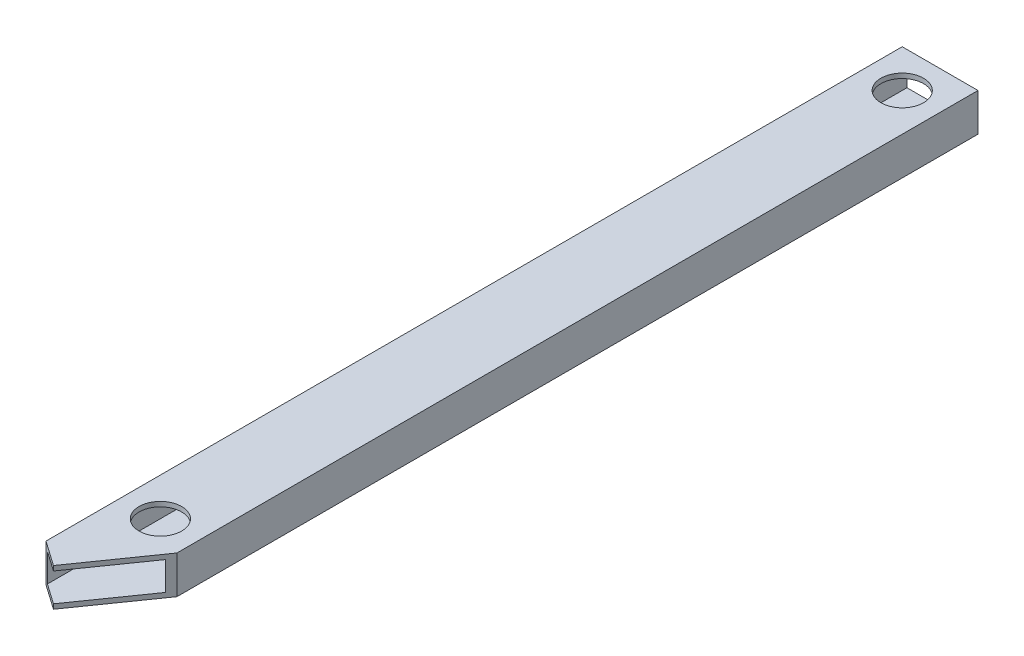
from build123d import *

# Parameters (mm, degrees)
SKETCH1_W           = 50.8
SKETCH1_H           = 25.4
BOSS_EXTRUDE1_DEPTH = 609.6
SKETCH2_W           = 44.45
SKETCH2_H           = 19.05
CUT_EXTRUDE1_DEPTH  = 609.6
CUT_EXTRUDE3_DEPTH  = 25.4
SKETCH6_R           = 14.2875
CUT_EXTRUDE5_DEPTH  = 3.175
SKETCH8_R           = 14.2875
CUT_EXTRUDE7_DEPTH  = 3.175


with BuildPart() as part:
    # Sketch1 → Boss-Extrude1 (new body)
    with BuildSketch(Plane.XY):
        with Locations((25.4, 12.7)):
            Rectangle(SKETCH1_W, SKETCH1_H)
    extrude(amount=BOSS_EXTRUDE1_DEPTH)

    # Sketch2 → Cut-Extrude1 (cut)
    with BuildSketch(Plane(origin=(0, 0, 0), x_dir=(-1, 0, 0), z_dir=(0, 0, -1))):
        with Locations((-25.4, 12.7)):
            Rectangle(SKETCH2_W, SKETCH2_H)
    extrude(amount=-CUT_EXTRUDE1_DEPTH, mode=Mode.SUBTRACT)

    # Sketch4 → Cut-Extrude3 (cut)
    with BuildSketch(Plane.XZ):
        Polygon((0, 574.029457059), (16.71268836, 585.731807432), (50.8, 537.050081257), (50.8, 609.6), (0, 609.6), align=None)
    extrude(amount=-CUT_EXTRUDE3_DEPTH, mode=Mode.SUBTRACT)

    # Sketch6 → Cut-Extrude5 (cut)
    with BuildSketch(Plane(origin=(0, 25.4, 0), x_dir=(1, 0, 0), z_dir=(0, 1, 0))):
        with Locations((25.4, -25.4)):
            Circle(SKETCH6_R)
    extrude(amount=-CUT_EXTRUDE5_DEPTH, mode=Mode.SUBTRACT)

    # Sketch8 → Cut-Extrude7 (cut)
    with BuildSketch(Plane(origin=(0, 25.4, 0), x_dir=(1, 0, 0), z_dir=(0, 1, 0))):
        with Locations((25.4, -522.762581257)):
            Circle(SKETCH8_R)
    extrude(amount=-CUT_EXTRUDE7_DEPTH, mode=Mode.SUBTRACT)


solid = part.part
